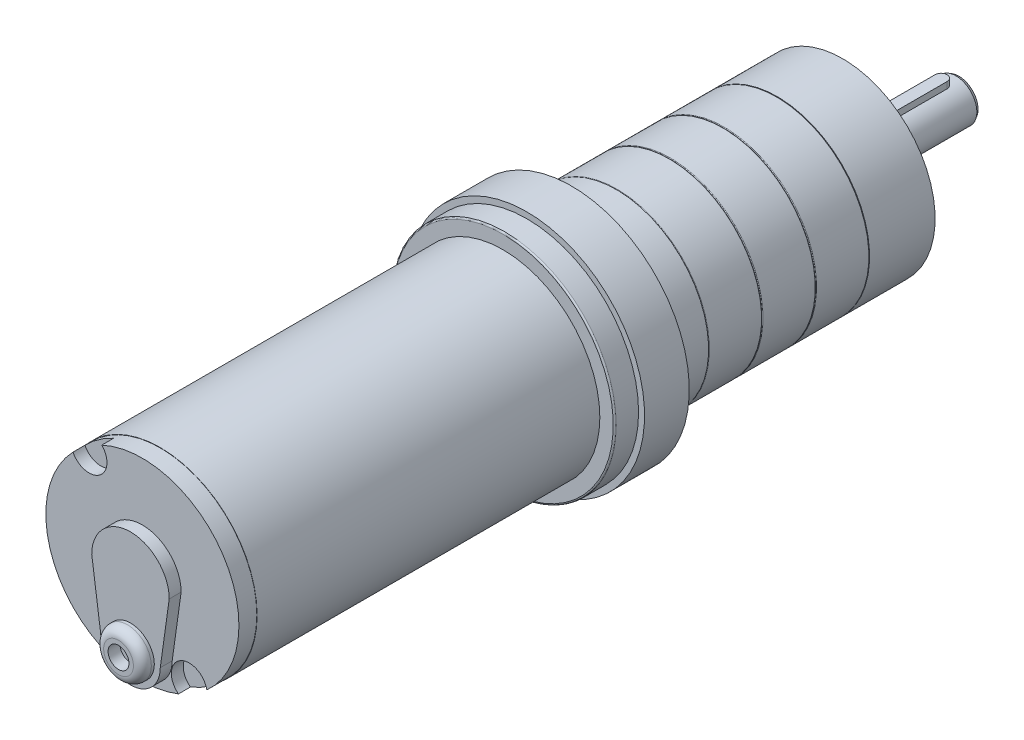
from build123d import *

# Parameters (mm, degrees)
SKETCH_1_R           = 32.5
EXTRUDE_1_DEPTH      = 115
SKETCH_2_R           = 32.4
EXTRUDE_2_DEPTH      = 6
EXTRUDE_3_DEPTH      = 4
SKETCH_5_R           = 8
EXTRUDE_4_DEPTH      = 4
FILLET_1_R           = 3
SKETCH_6_R           = 3.5
CUT_EXTRUDE_5_DEPTH  = 14
SKETCH_7_R           = 6
CUT_EXTRUDE_6_DEPTH  = 4
SKETCH_8_R           = 37.5
EXTRUDE_7_DEPTH      = 8
FILLET_4_R           = 0.5
SKETCH_9_R           = 39.5
EXTRUDE_8_DEPTH      = 15
SKETCH_10_R          = 31
EXTRUDE_9_DEPTH      = 15
SKETCH_13_R          = 31
EXTRUDE_12_DEPTH     = 18
SKETCH_14_R          = 31
EXTRUDE_14_DEPTH     = 18
FILLET_5_R           = 0.25
FILLET_7_R           = 0.25
FILLET_8_R           = 0.25
SKETCH_15_R          = 31
EXTRUDE_16_DEPTH     = 18
FILLET_9_R           = 0.25
FILLET_10_R          = 0.25
SKETCH_16_R          = 31
EXTRUDE_18_DEPTH     = 22
FILLET_11_R          = 0.25
SKETCH_17_R          = 20
EXTRUDE_19_DEPTH     = 5
SKETCH_18_R          = 7.5
EXTRUDE_20_DEPTH     = 4
SKETCH_19_R          = 7
EXTRUDE_21_DEPTH     = 30
CHAMFER_1_SIZE       = 1
CHAMFER_1_SIZE2      = 0.600860619
SKETCH_21_R          = 2.5
CUT_EXTRUDE_23_DEPTH = 16.5
EXTRUDE_START        = 6
EXTRUDE_27_DEPTH     = 2.85


with BuildPart() as part:
    # Эскиз1 → Вытянуть1 (new body)
    with BuildSketch(Plane.XY):
        Circle(SKETCH_1_R)
    extrude(amount=EXTRUDE_1_DEPTH)

    # Эскиз2 → Вытянуть2 (add)
    with BuildSketch(Plane.XY.offset(115)):
        Circle(SKETCH_2_R)
    extrude(amount=EXTRUDE_2_DEPTH)

    # Эскиз3 → Вытянуть3 (add)
    with BuildSketch(Plane.XY.offset(121)):
        with BuildLine():
            Line((-13, 0), (-10, -21.5))
            ThreePointArc((-10, -21.5), (0, -31.5), (10, -21.5))
            Line((10, -21.5), (13, 0))
            ThreePointArc((13, 0), (0, 13), (-13, 0))
        make_face()
    extrude(amount=EXTRUDE_3_DEPTH)

    # Эскиз5 → Вытянуть4 (add)
    with BuildSketch(Plane.XY.offset(125)):
        with Locations((0, -21.5)):
            Circle(SKETCH_5_R)
    extrude(amount=EXTRUDE_4_DEPTH)

    # Скругление1
    fillet_1_edges = [part.edges().sort_by_distance(p)[0] for p in [
        (-8, -21.5, 129),
    ]]
    fillet(fillet_1_edges, radius=FILLET_1_R)

    # Эскиз6 → Вытянуть5 (cut)
    with BuildSketch(Plane.XY.offset(125)):
        with Locations((0, -21.5)):
            Circle(SKETCH_6_R)
    extrude(amount=CUT_EXTRUDE_5_DEPTH, mode=Mode.SUBTRACT)

    # Эскиз7 → Вытянуть6 (cut)
    with BuildSketch(Plane.XY.offset(121)):
        with Locations((15.718136309, -25.2535154)):
            Circle(SKETCH_7_R)
        with Locations((-17.895163499, 25.166434312)):
            Circle(SKETCH_7_R)
    extrude(amount=-CUT_EXTRUDE_6_DEPTH, mode=Mode.SUBTRACT)

    # Эскиз8 → Вытянуть7 (add)
    with BuildSketch(Plane(origin=(0, 0, 0), x_dir=(-1, 0, 0), z_dir=(0, 0, -1))):
        Circle(SKETCH_8_R)
    extrude(amount=EXTRUDE_7_DEPTH)

    # Скругление4
    fillet_4_edges = [part.edges().sort_by_distance(p)[0] for p in [
        (37.5, 0, 0),
    ]]
    fillet(fillet_4_edges, radius=FILLET_4_R)

    # Эскиз9 → Вытянуть8 (add)
    with BuildSketch(Plane(origin=(0, 0, -8), x_dir=(-1, 0, 0), z_dir=(0, 0, -1))):
        Circle(SKETCH_9_R)
    extrude(amount=EXTRUDE_8_DEPTH)

    # Эскиз10 → Вытянуть9 (add)
    with BuildSketch(Plane(origin=(0, 0, -23), x_dir=(-1, 0, 0), z_dir=(0, 0, -1))):
        Circle(SKETCH_10_R)
    extrude(amount=EXTRUDE_9_DEPTH)


with BuildPart() as body_2:
    # Эскиз13 → Вытянуть12 (new body)
    with BuildSketch(Plane(origin=(0, 0, -38), x_dir=(-1, 0, 0), z_dir=(0, 0, -1))):
        Circle(SKETCH_13_R)
    extrude(amount=EXTRUDE_12_DEPTH)

    # Скругление5
    fillet_5_edges = [body_2.edges().sort_by_distance(p)[0] for p in [
        (31, 0, -38),
    ]]
    fillet(fillet_5_edges, radius=FILLET_5_R)

    # Скругление7
    fillet_7_edges = [body_2.edges().sort_by_distance(p)[0] for p in [
        (31, 0, -56),
    ]]
    fillet(fillet_7_edges, radius=FILLET_7_R)


with BuildPart() as body_3:
    # Эскиз14 → Вытянуть14 (new body)
    with BuildSketch(Plane(origin=(0, 0, -56), x_dir=(-1, 0, 0), z_dir=(0, 0, -1))):
        Circle(SKETCH_14_R)
    extrude(amount=EXTRUDE_14_DEPTH)

    # Скругление8
    fillet_8_edges = [body_3.edges().sort_by_distance(p)[0] for p in [
        (31, 0, -56),
    ]]
    fillet(fillet_8_edges, radius=FILLET_8_R)

    # Скругление9
    fillet_9_edges = [body_3.edges().sort_by_distance(p)[0] for p in [
        (31, 0, -74),
    ]]
    fillet(fillet_9_edges, radius=FILLET_9_R)


with BuildPart() as body_4:
    # Эскиз15 → Вытянуть16 (new body)
    with BuildSketch(Plane(origin=(0, 0, -74), x_dir=(-1, 0, 0), z_dir=(0, 0, -1))):
        Circle(SKETCH_15_R)
    extrude(amount=EXTRUDE_16_DEPTH)

    # Скругление10
    fillet_10_edges = [body_4.edges().sort_by_distance(p)[0] for p in [
        (31, 0, -74),
    ]]
    fillet(fillet_10_edges, radius=FILLET_10_R)

    # Скругление11
    fillet_11_edges = [body_4.edges().sort_by_distance(p)[0] for p in [
        (31, 0, -92),
    ]]
    fillet(fillet_11_edges, radius=FILLET_11_R)


with BuildPart() as body_5:
    # Эскиз16 → Вытянуть18 (new body)
    with BuildSketch(Plane(origin=(0, 0, -92), x_dir=(-1, 0, 0), z_dir=(0, 0, -1))):
        Circle(SKETCH_16_R)
    extrude(amount=EXTRUDE_18_DEPTH)

    # Эскиз21 → Вытянуть23 (cut)
    with BuildSketch(Plane(origin=(0, 0, -114), x_dir=(-1, 0, 0), z_dir=(0, 0, -1))):
        with Locations((0, 26.5)):
            Circle(SKETCH_21_R)
        with Locations(Location((0, -26.5, 0), (0, 0, 180))):
            Circle(SKETCH_21_R)
        with Locations((-26.5, 0)):
            Circle(SKETCH_21_R)
        with Locations(Location((26.5, 0, 0), (0, 0, 180))):
            Circle(SKETCH_21_R)
    extrude(amount=-CUT_EXTRUDE_23_DEPTH, mode=Mode.SUBTRACT)


with BuildPart() as body_6:
    # Эскиз17 → Вытянуть19 (new body)
    with BuildSketch(Plane(origin=(0, 0, -114), x_dir=(-1, 0, 0), z_dir=(0, 0, -1))):
        Circle(SKETCH_17_R)
    extrude(amount=EXTRUDE_19_DEPTH)


with BuildPart() as body_7:
    # Эскиз18 → Вытянуть20 (new body)
    with BuildSketch(Plane(origin=(0, 0, -119), x_dir=(-1, 0, 0), z_dir=(0, 0, -1))):
        Circle(SKETCH_18_R)
    extrude(amount=EXTRUDE_20_DEPTH)


with BuildPart() as body_8:
    # Эскиз19 → Вытянуть21 (new body)
    with BuildSketch(Plane(origin=(0, 0, -123), x_dir=(-1, 0, 0), z_dir=(0, 0, -1))):
        Circle(SKETCH_19_R)
    extrude(amount=EXTRUDE_21_DEPTH)

    # Фаска1
    chamfer_1_edges = [body_8.edges().sort_by_distance(p)[0] for p in [
        (7, 0, -153),
    ]]
    chamfer_1_side = [body_8.faces().sort_by_distance(p)[0] for p in [
        (7, 0, -138),
    ]]
    chamfer(chamfer_1_edges, length=CHAMFER_1_SIZE, length2=CHAMFER_1_SIZE2, reference=chamfer_1_side[0])

    # Эскиз20 → Вытянуть27 (add)
    with BuildSketch(Plane(origin=(0, 0, 0), x_dir=(1, 0, 0), z_dir=(0, 1, 0)).offset(EXTRUDE_START)):
        with BuildLine():
            Line((-2, 147), (-2, 130))
            ThreePointArc((-2, 130), (0, 128), (2, 130))
            Line((2, 130), (2, 147))
            ThreePointArc((2, 147), (0, 149), (-2, 147))
        make_face()
    extrude(amount=EXTRUDE_27_DEPTH)


solid = Compound([part.part, body_2.part, body_3.part, body_4.part, body_5.part, body_6.part, body_7.part, body_8.part])
